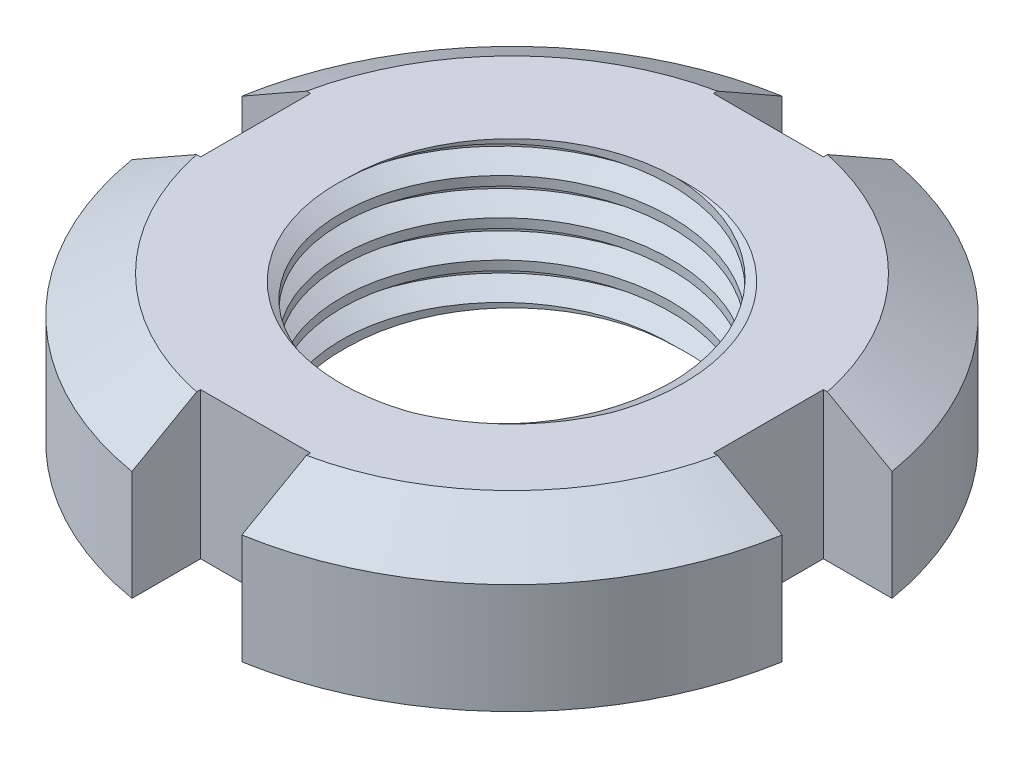
from build123d import *
from OCP.BRepFilletAPI import BRepFilletAPI_MakeChamfer

# Parameters (mm, degrees)
SKETCH1_R           = 4.5
BOSS_EXTRUDE1_DEPTH = 4
CHAMFER1_SIZE       = 1
CHAMFER1_SIZE2      = 1.732050808
THREAD1_PITCH       = 1


with BuildPart() as part:
    # Sketch1 → Boss-Extrude1 (new body)
    with BuildSketch(Plane(origin=(0, 0, 0), x_dir=(1, 0, 0), z_dir=(0, 1, 0))):
        with BuildLine():
            ThreePointArc((-1.5, 8.874119675), (-6.363961031, 6.363961031), (-8.874119675, 1.5))
            Line((-8.874119675, 1.5), (-7, 1.5))
            Line((-7, 1.5), (-7, -1.5))
            Line((-7, -1.5), (-8.874119675, -1.5))
            ThreePointArc((-8.874119675, -1.5), (-6.363961031, -6.363961031), (-1.5, -8.874119675))
            Line((-1.5, -8.874119675), (-1.5, -7))
            Line((-1.5, -7), (1.5, -7))
            Line((1.5, -7), (1.5, -8.874119675))
            ThreePointArc((1.5, -8.874119675), (6.363961031, -6.363961031), (8.874119675, -1.5))
            Line((8.874119675, -1.5), (7, -1.5))
            Line((7, -1.5), (7, 1.5))
            Line((7, 1.5), (8.874119675, 1.5))
            ThreePointArc((8.874119675, 1.5), (6.363961031, 6.363961031), (1.5, 8.874119675))
            Line((1.5, 8.874119675), (1.5, 7))
            Line((1.5, 7), (-1.5, 7))
            Line((-1.5, 7), (-1.5, 8.874119675))
        make_face()
        with Locations(Location((0, 0, 0), (0, 0, 270))):
            Circle(SKETCH1_R, mode=Mode.SUBTRACT)
    extrude(amount=BOSS_EXTRUDE1_DEPTH)

    # Chamfer1: one chamfer whose edges measure the first distance from different faces: ONE call of the kernel's chamfer builder (chamfer() names one face for all edges)
    chamfer1_edges_1 = [part.edges().sort_by_distance(p)[0] for p in [
        (6.363961031, 4, 6.363961031),
    ]]
    chamfer1_side_1 = [part.faces().sort_by_distance(p)[0] for p in [
        (6.363961031, 2, 6.363961031),
    ]]
    chamfer1_edges_2 = [part.edges().sort_by_distance(p)[0] for p in [
        (6.363961031, 4, -6.363961031),
    ]]
    chamfer1_side_2 = [part.faces().sort_by_distance(p)[0] for p in [
        (6.363961031, 2, -6.363961031),
    ]]
    chamfer1_edges_3 = [part.edges().sort_by_distance(p)[0] for p in [
        (-6.363961031, 4, -6.363961031),
    ]]
    chamfer1_side_3 = [part.faces().sort_by_distance(p)[0] for p in [
        (-6.363961031, 2, -6.363961031),
    ]]
    chamfer1_edges_4 = [part.edges().sort_by_distance(p)[0] for p in [
        (-6.363961031, 4, 6.363961031),
    ]]
    chamfer1_side_4 = [part.faces().sort_by_distance(p)[0] for p in [
        (-6.363961031, 2, 6.363961031),
    ]]
    chamfer1 = BRepFilletAPI_MakeChamfer(part.part.solid().wrapped)
    for e in chamfer1_edges_1:
        chamfer1.Add(CHAMFER1_SIZE, CHAMFER1_SIZE2, e.wrapped, chamfer1_side_1[0].wrapped)  # the first distance lies on this face
    for e in chamfer1_edges_2:
        chamfer1.Add(CHAMFER1_SIZE, CHAMFER1_SIZE2, e.wrapped, chamfer1_side_2[0].wrapped)  # the first distance lies on this face
    for e in chamfer1_edges_3:
        chamfer1.Add(CHAMFER1_SIZE, CHAMFER1_SIZE2, e.wrapped, chamfer1_side_3[0].wrapped)  # the first distance lies on this face
    for e in chamfer1_edges_4:
        chamfer1.Add(CHAMFER1_SIZE, CHAMFER1_SIZE2, e.wrapped, chamfer1_side_4[0].wrapped)  # the first distance lies on this face
    add(Compound.cast(chamfer1.Shape()), mode=Mode.REPLACE)

    # Thread1: the profile of Thread Profile1 profile screwed along a right-hand helix of 10 turns, 8 arcs to a turn; built about Z, then put on its axis
    thread1_z = Axis((0, 0, 0), (0, 0, 1))
    thread1_corners = [(4.4997, 0, -0.000173205), (5.041265875, 0, 0.312499999), (5.041265875, 0, 0.437499999), (4.4997, 0, 0.750173202)]
    with BuildLine(mode=Mode.PRIVATE) as thread1_profile:
        Line(thread1_corners[0], thread1_corners[1])
        Line(thread1_corners[1], thread1_corners[2])
        Line(thread1_corners[2], thread1_corners[3])
        Line(thread1_corners[3], thread1_corners[0])
    thread1_cap = Face(thread1_profile.wire())
    thread1_turn_angles = [0, 22.5, 45, 67.5, 90, 112.5, 135, 157.5, 180, 202.5, 225, 247.5, 270, 292.5, 315, 337.5, 360]
    thread1_turn_weights = [1, 0.9238795325112867, 1, 0.9238795325112867, 1, 0.9238795325112867, 1, 0.9238795325112867, 1, 0.9238795325112867, 1, 0.9238795325112867, 1, 0.9238795325112867, 1, 0.9238795325112867, 1]
    thread1_turn_rails = [Edge.make_bspline([Vector(p[0], p[1], 0).rotate(thread1_z, thread1_turn_angles[k]) / thread1_turn_weights[k] + Vector(0, 0, p[2] + THREAD1_PITCH * thread1_turn_angles[k] / 360) for k in range(17)], [0, 0, 0, 1, 1, 2, 2, 3, 3, 4, 4, 5, 5, 6, 6, 7, 7, 8, 8, 8], 2, thread1_turn_weights) for p in thread1_corners]
    thread1_turn_sides = [Face.make_surface_from_curves(thread1_turn_rails[p[0]], thread1_turn_rails[p[1]]) for p in [(0, 1), (1, 2), (2, 3), (3, 0)]]
    thread1 = Plane(origin=(0, 7, 0), x_dir=(-1, 0, 0), z_dir=(0, -1, 0)) * Solid(Shell([*[p.moved(Location((0, 0, THREAD1_PITCH * i))) for i in range(10) for p in thread1_turn_sides], thread1_cap, thread1_cap.rotate(thread1_z, 3600).moved(Location((0, 0, THREAD1_PITCH * 3600 / 360)))]))
    add(thread1, mode=Mode.SUBTRACT)


solid = part.part
